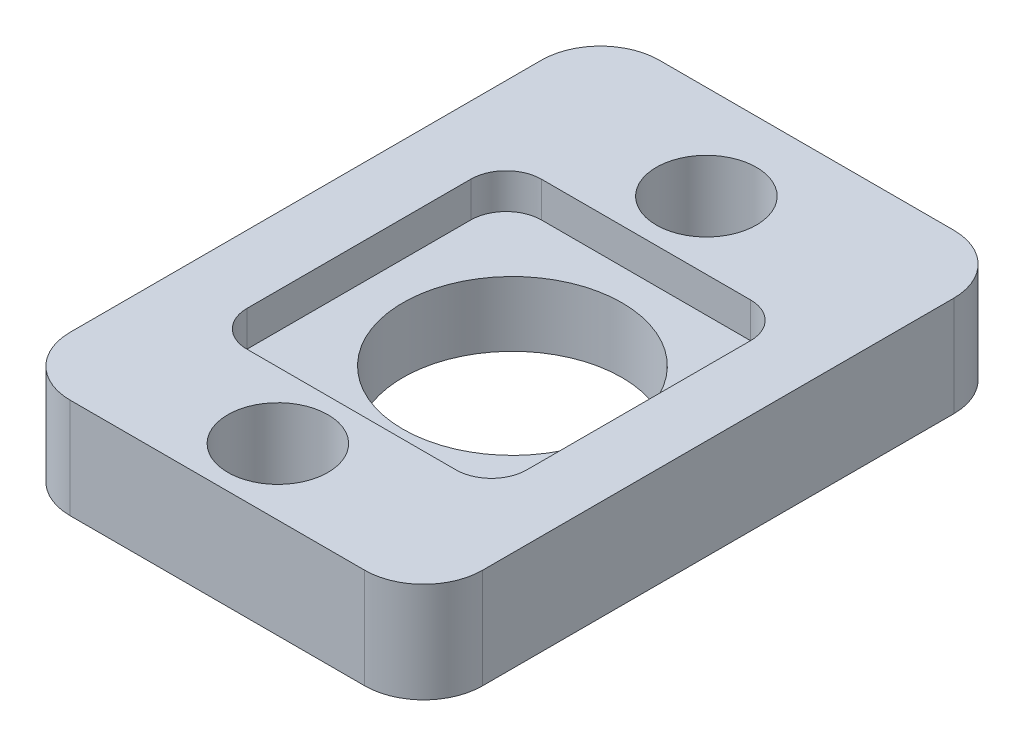
from build123d import *

# Parameters (mm, degrees)
BOSS_EXTRUDE1_DEPTH = 3.4
CUT_EXTRUDE1_DEPTH  = 1.2
SKETCH3_R           = 3.72
CUT_EXTRUDE2_DEPTH  = 25.512037859
SKETCH4_R           = 1.7
CUT_EXTRUDE3_DEPTH  = 25.648732219


with BuildPart() as part:
    # Sketch1 → Boss-Extrude1 (new body)
    with BuildSketch(Plane(origin=(0, 0, 0), x_dir=(1, 0, 0), z_dir=(0, 1, 0))):
        with BuildLine():
            Line((2, 0), (12, 0))
            ThreePointArc((12, 0), (13.414213562, -0.585786438), (14, -2))
            Line((14, -2), (14, -18))
            ThreePointArc((14, -18), (13.414213562, -19.414213562), (12, -20))
            Line((12, -20), (2, -20))
            ThreePointArc((2, -20), (0.585786438, -19.414213562), (0, -18))
            Line((0, -18), (0, -2))
            ThreePointArc((0, -2), (0.585786438, -0.585786438), (2, 0))
        make_face()
    extrude(amount=BOSS_EXTRUDE1_DEPTH)

    # Sketch2 → Cut-Extrude1 (cut)
    with BuildSketch(Plane(origin=(0, 3.4, 0), x_dir=(1, 0, 0), z_dir=(0, 1, 0))):
        with BuildLine():
            Line((3.5, -5.5), (10.6, -5.5))
            ThreePointArc((10.6, -5.5), (11.448528137, -5.851471863), (11.8, -6.7))
            Line((11.8, -6.7), (11.8, -14.3))
            ThreePointArc((11.8, -14.3), (11.448528137, -15.148528137), (10.6, -15.5))
            Line((10.6, -15.5), (3.5, -15.5))
            ThreePointArc((3.5, -15.5), (2.651471863, -15.148528137), (2.3, -14.3))
            Line((2.3, -14.3), (2.3, -6.7))
            ThreePointArc((2.3, -6.7), (2.651471863, -5.851471863), (3.5, -5.5))
        make_face()
    extrude(amount=-CUT_EXTRUDE1_DEPTH, mode=Mode.SUBTRACT)

    # Sketch3 → Cut-Extrude2 (cut, through all)
    with BuildSketch(Plane(origin=(0, 2.2, 0), x_dir=(1, 0, 0), z_dir=(0, 1, 0))):
        with Locations((7.3, -10.28537143)):
            Circle(SKETCH3_R)
    extrude(amount=-CUT_EXTRUDE2_DEPTH, mode=Mode.SUBTRACT)

    # Sketch4 → Cut-Extrude3 (cut, through all)
    with BuildSketch(Plane(origin=(0, 3.4, 0), x_dir=(1, 0, 0), z_dir=(0, 1, 0))):
        with Locations((6.8, -3.2)):
            Circle(SKETCH4_R)
        with Locations((6.8, -17.749813514)):
            Circle(SKETCH4_R)
    extrude(amount=-CUT_EXTRUDE3_DEPTH, mode=Mode.SUBTRACT)


solid = part.part
